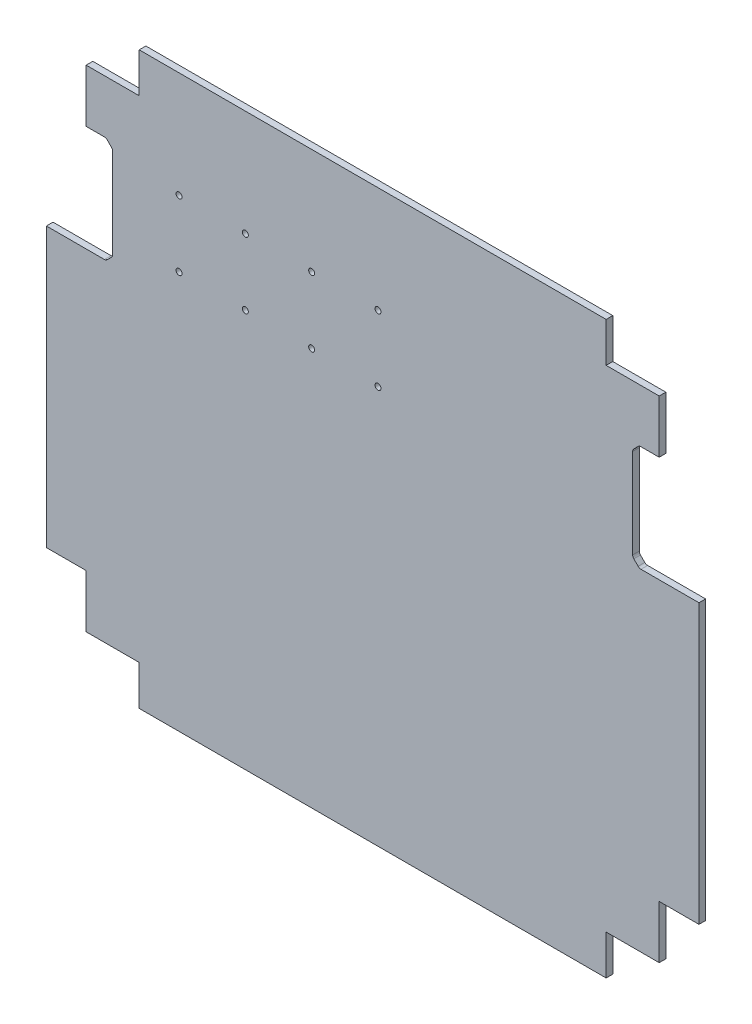
from build123d import *

# Parameters (mm, degrees)
SALIENTE_EXTRUIR1_DEPTH = 5
CROQUIS3_W              = 50
CROQUIS3_H              = 80
CORTAR_EXTRUIR2_DEPTH   = 10
CHAFL_N1_SIZE           = 5
REDONDEO1_R             = 3
CROQUIS4_R              = 2.25
CORTAR_EXTRUIR3_DEPTH   = 5


with BuildPart() as part:
    # Croquis1 → Saliente-Extruir1 (new body)
    with BuildSketch(Plane.XY):
        Polygon((-246, 145), (-246, -145), (-216, -145), (-216, -185), (-176, -185), (-176, -215), (176, -215), (176, -185), (216, -185), (216, -145), (246, -145), (246, 145), (216, 145), (216, 185), (176, 185), (176, 215), (-176, 215), (-176, 185), (-216, 185), (-216, 145), align=None)
    extrude(amount=SALIENTE_EXTRUIR1_DEPTH)

    # Croquis3 → Cortar-Extruir2 (cut)
    with BuildSketch(Plane.XY.offset(5)):
        with Locations((-221, 105)):
            Rectangle(CROQUIS3_W, CROQUIS3_H)
        with Locations((221, 105)):
            Rectangle(CROQUIS3_W, CROQUIS3_H)
    extrude(amount=-CORTAR_EXTRUIR2_DEPTH, mode=Mode.SUBTRACT)

    # Chaflán1
    chafl_n1_edges = [part.edges().sort_by_distance(p)[0] for p in [
        (-196, 65, 2.5),
        (-196, 145, 2.5),
        (196, 65, 2.5),
        (196, 145, 2.5),
    ]]
    chamfer(chafl_n1_edges, length=CHAFL_N1_SIZE)

    # Redondeo1
    redondeo1_edges = [part.edges().sort_by_distance(p)[0] for p in [
        (196, 140, 2.5),
        (201, 145, 2.5),
        (201, 65, 2.5),
        (196, 70, 2.5),
        (-196, 140, 2.5),
        (-201, 145, 2.5),
        (-201, 65, 2.5),
        (-196, 70, 2.5),
    ]]
    fillet(redondeo1_edges, radius=REDONDEO1_R)

    # Croquis4 → Cortar-Extruir3 (cut, symmetric)
    with BuildSketch(Plane.XY.offset(5)):
        with Locations((-146, 135)):
            Circle(CROQUIS4_R)
        with Locations((-96, 135)):
            Circle(CROQUIS4_R)
        with Locations((-146, 85)):
            Circle(CROQUIS4_R)
        with Locations((-96, 85)):
            Circle(CROQUIS4_R)
        with Locations((-46, 135)):
            Circle(CROQUIS4_R)
        with Locations((-46, 85)):
            Circle(CROQUIS4_R)
        with Locations((4, 135)):
            Circle(CROQUIS4_R)
        with Locations((4, 85)):
            Circle(CROQUIS4_R)
    extrude(amount=CORTAR_EXTRUIR3_DEPTH, both=True, mode=Mode.SUBTRACT)


solid = part.part
